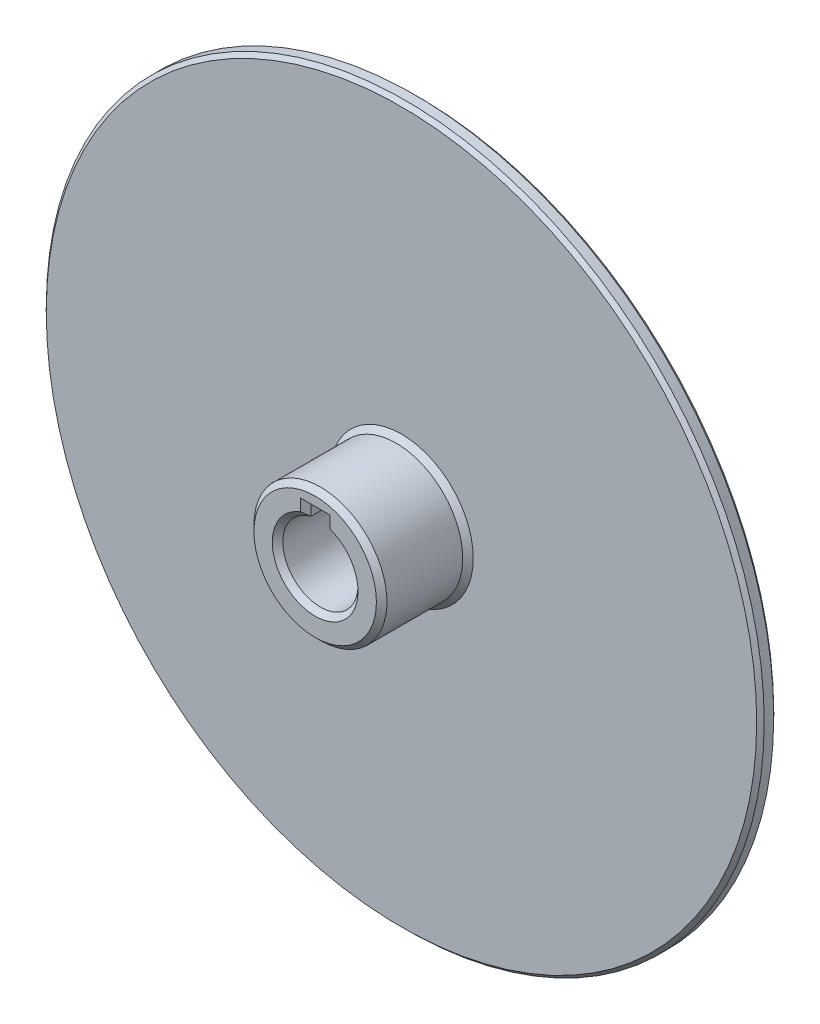
from build123d import *

# Parameters (mm, degrees)
SKETCH1_R               = 121.331498574
BOSS_EXTRUDE1_DEPTH     = 5.7658
SKETCH2_R               = 22.479
BOSS_EXTRUDE2_DEPTH     = 29.174948
CUT_EXTRUDE1_DEPTH      = 176.110025307
CUT_EXTRUDE1_DEPTH_BACK = 176.110025307
SKETCH3_R               = 12.7
CUT_EXTRUDE2_DEPTH      = 176.110025307
CUT_EXTRUDE2_DEPTH_BACK = 176.110025307
SKETCH4_W               = 6.35
SKETCH4_H               = 6.35
CHAMFER1_SIZE           = 1.27
CHAMFER2_SIZE           = 1.778


with BuildPart() as part:
    # Sketch1 → Boss-Extrude1 (new body)
    with BuildSketch(Plane.XY):
        Circle(SKETCH1_R)
    extrude(amount=BOSS_EXTRUDE1_DEPTH)

    # Sketch2 → Boss-Extrude2 (add)
    with BuildSketch(Plane.XY.offset(5.7658)):
        Circle(SKETCH2_R)
    extrude(amount=BOSS_EXTRUDE2_DEPTH)

    # Sketch3 → Cut-Extrude1 (cut, two sides: drawn at the far end of the back side and taken through both)
    with BuildSketch(Plane.XY.offset(34.940748).offset(-CUT_EXTRUDE1_DEPTH_BACK)):
        Circle(SKETCH3_R)
    extrude(amount=CUT_EXTRUDE1_DEPTH + CUT_EXTRUDE1_DEPTH_BACK, mode=Mode.SUBTRACT)

    # Sketch4 → Cut-Extrude2 (cut, two sides: drawn at the far end of the back side and taken through both)
    with BuildSketch(Plane.XY.offset(34.940748).offset(-CUT_EXTRUDE2_DEPTH_BACK)):
        with Locations((0, 12.7)):
            Rectangle(SKETCH4_W, SKETCH4_H)
    extrude(amount=CUT_EXTRUDE2_DEPTH + CUT_EXTRUDE2_DEPTH_BACK, mode=Mode.SUBTRACT)

    # Chamfer1
    chamfer1_edges = [part.edges().sort_by_distance(p)[0] for p in [
        (-121.331498574, 0, 0),
        (-121.331498574, 0, 5.7658),
    ]]
    chamfer(chamfer1_edges, length=CHAMFER1_SIZE)

    # Chamfer2
    chamfer2_edges = [part.edges().sort_by_distance(p)[0] for p in [
        (3.175, 14.085861062, 0),
        (0, -12.7, 0),
        (-3.175, 14.085861062, 0),
        (0, 15.875, 0),
        (3.175, 14.085861062, 34.940748),
        (0, 15.875, 34.940748),
        (-3.175, 14.085861062, 34.940748),
        (0, -12.7, 34.940748),
        (-22.479, 0, 5.7658),
        (-22.479, 0, 34.940748),
    ]]
    chamfer(chamfer2_edges, length=CHAMFER2_SIZE)


solid = part.part
